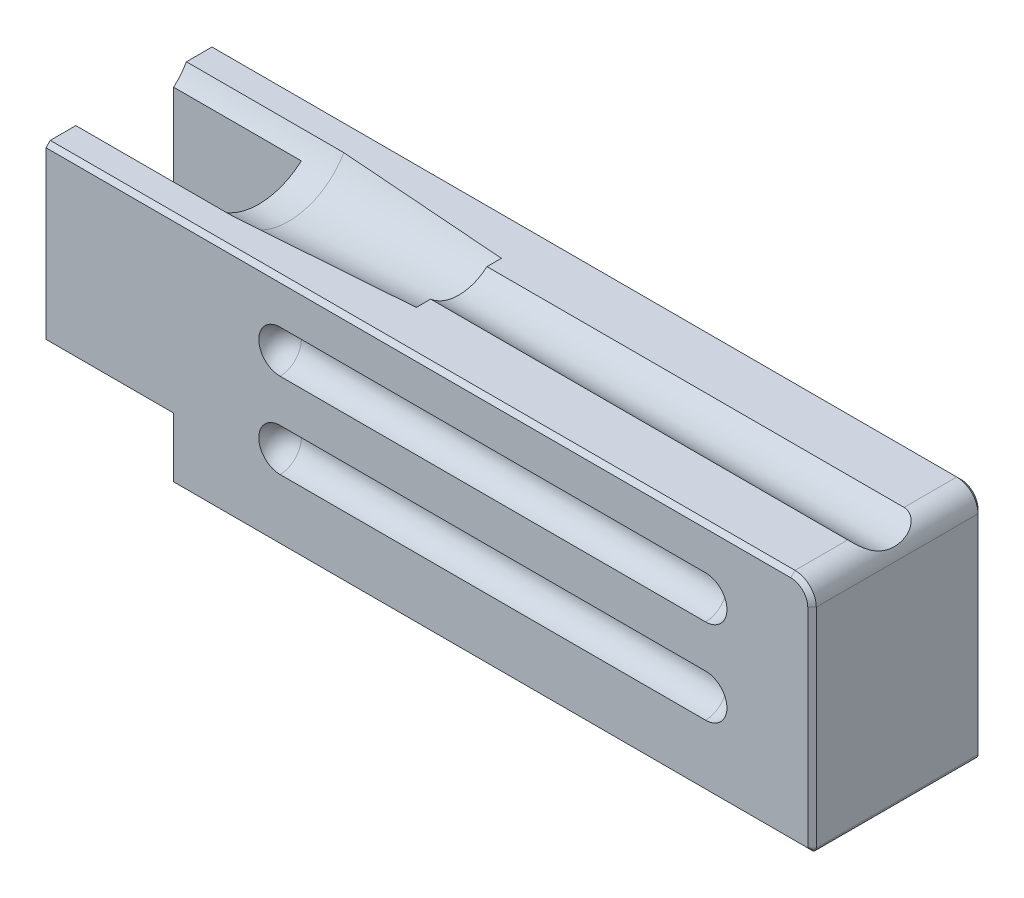
from build123d import *

# Parameters (mm, degrees)
EXTRUDE_1_DEPTH                = 20
SKETCH_2_W                     = 30
SKETCH_2_H                     = 40
CUT_EXTRUDE_1_DEPTH            = 10
FILLET_1_R                     = 5
FILLET_2_R                     = 1
CUT_EXTRUDE_2_DEPTH            = 37
CUT_EXTRUDE_3_DEPTH            = 190.274932307
CHAMFER_1_SIZE                 = 1
CUT_EXTRUDE_4_DEPTH            = 5
FILLET_3_R                     = 5
PATTERN_LINEAR_7_COUNT         = 2
PATTERN_LINEAR_7_PITCH         = 20
FILLET_3_OF_PATTERN_LINEAR_7_R = 5
SKETCH_7_R                     = 3
CUT_EXTRUDE_5_DEPTH            = 10


# Read off the part's stored shape, not the designer's step: 대칭 복사4
with BuildPart() as part:
    # 스케치1 → 보스-돌출1 (new, symmetric)
    with BuildSketch(Plane.XY):
        Polygon((0, -40), (30, -40), (30, -55), (180, -55), (180, 0), (0, 0), align=None)
    extrude(amount=EXTRUDE_1_DEPTH, both=True)

    # 스케치2 → 컷-돌출1 (cut, symmetric)
    with BuildSketch(Plane.XY):
        with Locations((15, -20)):
            Rectangle(SKETCH_2_W, SKETCH_2_H)
    extrude(amount=CUT_EXTRUDE_1_DEPTH, both=True, mode=Mode.SUBTRACT)

    # 필렛1
    fillet_1_edges = [part.edges().sort_by_distance(p)[0] for p in [
        (180, 0, 0),
    ]]
    fillet(fillet_1_edges, radius=FILLET_1_R)

    # 필렛2
    fillet_2_edges = [part.edges().sort_by_distance(p)[0] for p in [
        (180, -55, 0),
    ]]
    fillet(fillet_2_edges, radius=FILLET_2_R)

    # 스케치3 → 컷-돌출2 (cut)
    with BuildSketch(Plane.ZY):
        with BuildLine():
            Line((-12.990381057, 0), (12.990381057, 0))
            ThreePointArc((12.990381057, 0), (0, -7.5), (-12.990381057, 0))
        make_face()
    extrude(amount=-CUT_EXTRUDE_2_DEPTH, mode=Mode.SUBTRACT)

    # 스케치4 → 컷-돌출3 (cut, through all)
    with BuildSketch(Plane(origin=(180, 0, 0), x_dir=(0, 0, -1), z_dir=(1, 0, 0))):
        with BuildLine():
            Line((-6.614378278, 0), (6.614378278, 0))
            ThreePointArc((6.614378278, 0), (0, -2.5), (-6.614378278, 0))
        make_face()
    extrude(amount=-CUT_EXTRUDE_3_DEPTH, mode=Mode.SUBTRACT)

    # 스케치6 for 컷-로프트1 → 컷-로프트1 section 0
    with BuildSketch(Plane.ZY.offset(-37)):
        with BuildLine():
            Line((-12.990381057, 0), (12.990381057, 0))
            # circular arc as an exact rational Bezier (weights 1, cos(half-angle), 1)
            Bezier((12.990381057, 0), (0, -22.5), (-12.990381057, 0), weights=[1, 0.5, 1])
        make_face()
    # 스케치5 for 컷-로프트1 → 컷-로프트1 section 1
    with BuildSketch(Plane.ZY.offset(-77)):
        with BuildLine():
            Line((-10, 0), (10, 0))
            Bezier((10, 0), (0, -13.333333333), (-10, 0), weights=[1, 0.6, 1])
        make_face()
    loft(mode=Mode.SUBTRACT)

    # 모따기1
    chamfer_1_edges = [part.edges().sort_by_distance(p)[0] for p in [
        (104.5, -55, 20),
        (87.5, 0, 20),
        (180, -29.5, -20),
        (178.535533906, -1.464466094, -20),
        (180, -29.5, 20),
        (178.535533906, -1.464466094, 20),
        (179.707106781, -54.707106781, -20),
        (179.707106781, -54.707106781, 20),
        (87.5, 0, -20),
        (104.5, -55, -20),
    ]]
    chamfer(chamfer_1_edges, length=CHAMFER_1_SIZE)

    # 스케치8 → 컷-돌출4 (cut)
    with BuildSketch(Plane.XY.offset(20)):
        with BuildLine():
            Line((55, -10), (155, -10))
            ThreePointArc((155, -10), (160, -15), (155, -20))
            Line((155, -20), (55, -20))
            ThreePointArc((55, -20), (50, -15), (55, -10))
        make_face()
    cut_extrude_4 = extrude(amount=-CUT_EXTRUDE_4_DEPTH, mode=Mode.SUBTRACT)

    # 필렛3
    fillet_3_edges = [part.edges().sort_by_distance(p)[0] for p in [
        (105, -20, 15),
        (105, -10, 15),
        (50, -15, 15),
        (160, -15, 15),
    ]]
    fillet(fillet_3_edges, radius=FILLET_3_R - 0.0001)  # a hair under: the kernel refuses the full size

    # 선형 패턴7: 컷-돌출4 ×2
    with Locations(*[(0, -i * PATTERN_LINEAR_7_PITCH, 0) for i in range(1, PATTERN_LINEAR_7_COUNT)]):
        add(cut_extrude_4, mode=Mode.SUBTRACT)

    # 필렛3 of 선형 패턴7
    fillet_3_of_pattern_linear_7_edges = [part.edges().sort_by_distance(p)[0] for p in [
        (105, -40, 15),
        (105, -30, 15),
        (50, -35, 15),
        (160, -35, 15),
    ]]
    fillet(fillet_3_of_pattern_linear_7_edges, radius=FILLET_3_OF_PATTERN_LINEAR_7_R - 0.0001)  # a hair under: the kernel refuses the full size

    # 대칭 복사4 outline → 대칭 복사4 (revolve, cut)
    with BuildSketch(Plane(origin=(0, -15, -20), x_dir=(0, 1, 0), z_dir=(0, 0, -1))):
        with BuildLine():
            ThreePointArc((0, 50), (3.535533906, 51.464466094), (5, 55))
            Line((5, 55), (5, 155))
            ThreePointArc((5, 155), (3.535533906, 158.535533906), (0, 160))
            Line((0, 160), (0, 50))
        make_face()
    revolve(axis=Axis((0, -15, -20), (1, 0, 0)), mode=Mode.SUBTRACT)

    # Mirror 4 2 outline → Mirror 4 2 (revolve, cut)
    with BuildSketch(Plane(origin=(0, -35, -20), x_dir=(0, 1, 0), z_dir=(0, 0, -1))):
        with BuildLine():
            ThreePointArc((0, 50), (3.535533906, 51.464466094), (5, 55))
            Line((5, 55), (5, 155))
            ThreePointArc((5, 155), (3.535533906, 158.535533906), (0, 160))
            Line((0, 160), (0, 50))
        make_face()
    revolve(axis=Axis((0, -35, -20), (1, 0, 0)), mode=Mode.SUBTRACT)

    # 스케치7 → 컷-돌출5 (cut)
    with BuildSketch(Plane.XZ.offset(55)):
        with Locations(Location((165, 0, 0), (0, 0, 270))):
            Circle(SKETCH_7_R)
        with Locations(Location((110, 0, 0), (0, 0, 270))):
            Circle(SKETCH_7_R)
    extrude(amount=-CUT_EXTRUDE_5_DEPTH, mode=Mode.SUBTRACT)


solid = part.part
